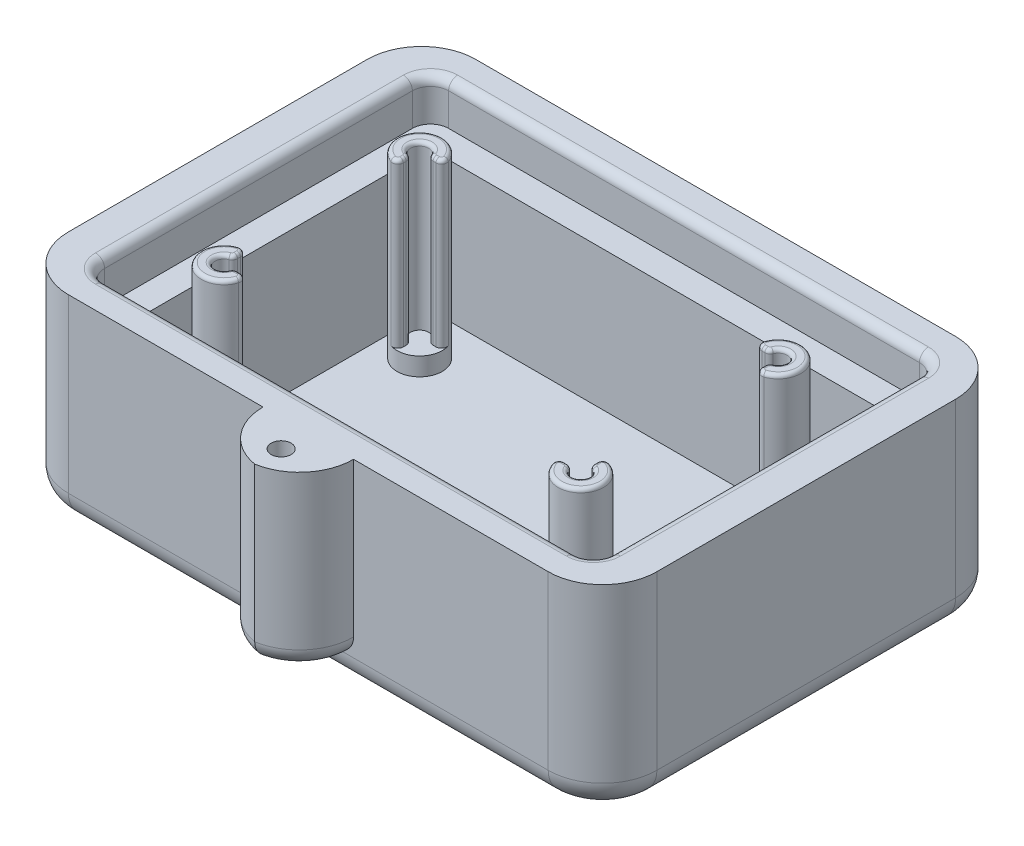
from build123d import *

# Parameters (mm, degrees)
SKETCH1_W               = 82.55
SKETCH1_H               = 57.15
BOSS_EXTRUDE1_DEPTH     = 27.94
FILLET2_R               = 7.62
FILLET3_R               = 3.81
SKETCH2_W               = 63.5
SKETCH2_H               = 40.64
CUT_EXTRUDE1_DEPTH      = 25.4
SKETCH9_W               = 12.7
SKETCH9_H               = 24.13
BOSS_EXTRUDE5_DEPTH     = 7.62
FILLET10_R              = 7.62
SKETCH7_W               = 71.12
SKETCH7_H               = 48.26
CUT_EXTRUDE4_DEPTH      = 5.842
FILLET12_R              = 2.54
FILLET13_R              = 1.27
SKETCH5_R               = 3.175
BOSS_EXTRUDE6_DEPTH     = 25.4
SKETCH11_R              = 1.27
CUT_EXTRUDE5_DEPTH      = 22.86
CUT_EXTRUDE_THIN1_DEPTH = 103.971863203
SKETCH20_R              = 1.397
CUT_EXTRUDE6_DEPTH      = 104.261231406
FILLET14_R              = 2.54
FILLET16_R              = 0.762
FILLET17_R              = 0.508


with BuildPart() as part:
    # Sketch1 → Boss-Extrude1 (new body)
    with BuildSketch(Plane(origin=(0, 0, 0), x_dir=(1, 0, 0), z_dir=(0, 1, 0))):
        with Locations((41.275, 28.575)):
            Rectangle(SKETCH1_W, SKETCH1_H)
    extrude(amount=BOSS_EXTRUDE1_DEPTH)

    # Fillet2
    fillet2_edges = [part.edges().sort_by_distance(p)[0] for p in [
        (0, 13.97, -57.15),
        (82.55, 13.97, -57.15),
        (82.55, 13.97, 0),
        (0, 13.97, 0),
    ]]
    fillet(fillet2_edges, radius=FILLET2_R)

    # Fillet3
    fillet3_edges = [part.edges().sort_by_distance(p)[0] for p in [
        (41.275, 0, -57.15),
        (0, 0, -28.575),
        (82.55, 0, -28.575),
        (41.275, 0, 0),
        (2.231846327, 0, -54.918153673),
        (2.231846327, 0, -2.231846327),
        (80.318153673, 0, -2.231846327),
        (80.318153673, 0, -54.918153673),
    ]]
    fillet(fillet3_edges, radius=FILLET3_R)

    # Sketch2 → Cut-Extrude1 (cut)
    with BuildSketch(Plane(origin=(0, 27.94, 0), x_dir=(1, 0, 0), z_dir=(0, 1, 0))):
        with Locations((41.275, 28.575)):
            Rectangle(SKETCH2_W, SKETCH2_H)
    extrude(amount=-CUT_EXTRUDE1_DEPTH, mode=Mode.SUBTRACT)

    # Sketch9 → Boss-Extrude5 (add)
    with BuildSketch(Plane.XY):
        with Locations((41.275, 15.875)):
            Rectangle(SKETCH9_W, SKETCH9_H)
    extrude(amount=BOSS_EXTRUDE5_DEPTH)

    # Fillet10
    # the kernel refuses this fillet: 7.62 mm, written as the material it takes off along each edge
    with BuildSketch(Plane(origin=(47.625, -15.24, 7.62), x_dir=(-1, 0, 0), z_dir=(0, 1, 0))) as fillet10_piece_1:
        with BuildLine():
            CenterArc((FILLET10_R, -FILLET10_R), FILLET10_R, 90, 90)
            Line((0, -FILLET10_R), (0, 0))
            Line((0, 0), (FILLET10_R, 0))
        make_face()
    extrude(amount=62.23, mode=Mode.SUBTRACT)
    with BuildSketch(Plane(origin=(34.925, 46.99, 7.62), x_dir=(0, 0, -1), z_dir=(0, -1, 0))) as fillet10_piece_2:
        with BuildLine():
            CenterArc((FILLET10_R, FILLET10_R), FILLET10_R, 180, 90)
            Line((0, FILLET10_R), (0, 0))
            Line((0, 0), (FILLET10_R, 0))
        make_face()
    extrude(amount=62.23, mode=Mode.SUBTRACT)

    # Sketch7 → Cut-Extrude4 (cut)
    with BuildSketch(Plane(origin=(0, 27.94, 0), x_dir=(1, 0, 0), z_dir=(0, 1, 0))):
        with Locations((41.275, 28.575)):
            Rectangle(SKETCH7_W, SKETCH7_H)
    extrude(amount=-CUT_EXTRUDE4_DEPTH, mode=Mode.SUBTRACT)

    # Fillet12
    fillet12_edges = [part.edges().sort_by_distance(p)[0] for p in [
        (5.715, 25.019, -52.705),
        (76.835, 25.019, -52.705),
        (76.835, 25.019, -4.445),
        (5.715, 25.019, -4.445),
    ]]
    fillet(fillet12_edges, radius=FILLET12_R)

    # Fillet13
    fillet13_edges = [part.edges().sort_by_distance(p)[0] for p in [
        (41.275, 27.94, -52.705),
        (76.835, 27.94, -28.575),
        (41.275, 27.94, -4.445),
        (5.715, 27.94, -28.575),
        (76.091051224, 27.94, -51.961051224),
        (76.091051224, 27.94, -5.188948776),
        (6.458948776, 27.94, -51.961051224),
        (6.458948776, 27.94, -5.188948776),
    ]]
    fillet(fillet13_edges, radius=FILLET13_R)

    # Sketch5 → Boss-Extrude6 (add)
    with BuildSketch(Plane(origin=(0, 2.54, 0), x_dir=(1, 0, 0), z_dir=(0, 1, 0))):
        with Locations(Location((14.605, 42.291, 0), (0, 0, 90))):
            Circle(SKETCH5_R)
        with Locations(Location((14.605, 14.859, 0), (0, 0, 90))):
            Circle(SKETCH5_R)
        with Locations(Location((64.897, 42.291, 0), (0, 0, 90))):
            Circle(SKETCH5_R)
        with Locations(Location((64.896358582, 14.605, 0), (0, 0, 90))):
            Circle(SKETCH5_R)
    extrude(amount=BOSS_EXTRUDE6_DEPTH)

    # Sketch11 → Cut-Extrude5 (cut)
    with BuildSketch(Plane(origin=(0, 27.94, 0), x_dir=(1, 0, 0), z_dir=(0, 1, 0))):
        with Locations(Location((14.605, 14.859, 0), (0, 0, 270))):
            Circle(SKETCH11_R)
        with Locations(Location((14.605, 42.291, 0), (0, 0, 270))):
            Circle(SKETCH11_R)
        with Locations(Location((64.896358582, 14.605, 0), (0, 0, 270))):
            Circle(SKETCH11_R)
        with Locations(Location((64.897, 42.291, 0), (0, 0, 270))):
            Circle(SKETCH11_R)
    extrude(amount=-CUT_EXTRUDE5_DEPTH, mode=Mode.SUBTRACT)

    # Sketch17 → Cut-Extrude-Thin1 (cut, through all)
    with BuildSketch(Plane(origin=(0, 5.08, 0), x_dir=(1, 0, 0), z_dir=(0, 1, 0))):
        with BuildLine():
            ThreePointArc((18.78, 42.291), (17.557170811, 39.338829189), (14.605, 38.116))
            Line((14.605, 38.116), (14.605, 41.656))
            ThreePointArc((14.605, 41.656), (15.054012806, 41.841987194), (15.24, 42.291))
            Line((15.24, 42.291), (18.78, 42.291))
        make_face()
        with BuildLine():
            ThreePointArc((60.721358582, 14.605), (61.94418777, 17.557170811), (64.896358582, 18.78))
            Line((64.896358582, 18.78), (64.896358582, 15.24))
            ThreePointArc((64.896358582, 15.24), (64.447345776, 15.054012806), (64.261358582, 14.605))
            Line((64.261358582, 14.605), (60.721358582, 14.605))
        make_face()
        with BuildLine():
            ThreePointArc((14.605, 19.034), (17.557170811, 17.811170811), (18.78, 14.859))
            Line((18.78, 14.859), (15.24, 14.859))
            ThreePointArc((15.24, 14.859), (15.054012806, 15.308012806), (14.605, 15.494))
            Line((14.605, 15.494), (14.605, 19.034))
        make_face()
        with BuildLine():
            ThreePointArc((64.627, 42.291), (64.706081169, 42.100081169), (64.897, 42.021))
            Line((64.897, 42.021), (64.897, 38.481))
            ThreePointArc((64.897, 38.481), (62.202923164, 39.596923164), (61.087, 42.291))
            Line((61.087, 42.291), (64.627, 42.291))
        make_face()
    extrude(amount=CUT_EXTRUDE_THIN1_DEPTH, mode=Mode.SUBTRACT)

    # Sketch20 → Cut-Extrude6 (cut, through all)
    with BuildSketch(Plane.XZ.offset(-3.81)):
        with Locations(Location((41.275, 3.81, 0), (0, 0, 270))):
            Circle(SKETCH20_R)
    extrude(amount=-CUT_EXTRUDE6_DEPTH, mode=Mode.SUBTRACT)

    # Fillet14
    # the kernel refuses this fillet: 2.54 mm, written as the material it takes off along each edge
    with BuildSketch(Plane(origin=(42.545, 3.81, 0), x_dir=(-1, 0, 0), z_dir=(0, 0, -1))) as fillet14_piece_1:
        with BuildLine():
            CenterArc((7.62 - FILLET14_R, FILLET14_R), FILLET14_R, 270, 90)
            Line((7.62 - FILLET14_R, 0), (7.62, 0))
            Line((7.62, 0), (7.62, FILLET14_R))
        make_face()
    revolve(axis=Axis((42.545, 3.81, 0), (0, 1, 0)), revolution_arc=128.167722704, mode=Mode.SUBTRACT)
    with BuildSketch(Plane(origin=(40.005, 3.81, 0), x_dir=(1, 0, 0), z_dir=(0, 0, -1))) as fillet14_piece_2:
        with BuildLine():
            CenterArc((7.62 - FILLET14_R, -FILLET14_R), FILLET14_R, 0, 90)
            Line((7.62 - FILLET14_R, 0), (7.62, 0))
            Line((7.62, 0), (7.62, -FILLET14_R))
        make_face()
    revolve(axis=Axis((40.005, 3.81, 0), (0, -1, 0)), revolution_arc=128.167722704, mode=Mode.SUBTRACT)

    # Fillet16
    # the kernel refuses this fillet: 0.762 mm, written as the material it takes off along each edge
    with BuildSketch(Plane(origin=(14.605, 30.47927354, -39.116), x_dir=(-0.9871244306106606, 0, -0.1599542387421456), z_dir=(0, -1, 0)), Plane(origin=(17.78, 30.47927354, -14.859), x_dir=(-0.15995423874214412, 0, 0.9871244306106608), z_dir=(0, -1, 0)), Plane(origin=(14.605, 5.08, -18.034), x_dir=(-0.9871244306106601, 0, 0.1599542387421475), z_dir=(0, 1, 0)), Plane(origin=(61.722, 30.47927354, -42.291), x_dir=(0.15995423874221992, 0, -0.9871244306106485), z_dir=(0, -1, 0))) as fillet16_piece_1:
        with BuildLine():
            CenterArc((0.893824286, 0.752188816), FILLET16_R, 170.795759915, 108.408480171)
            Line((0.14163547, 0.874073946), (0, 0))
            ThreePointArc((0, 0), (0.507854708, -0.040879933), (1.015709416, 0))
        make_face()
    extrude(amount=25.39927354, mode=Mode.SUBTRACT)
    with BuildSketch(Plane(origin=(14.605, 29.474286039, -41.021), x_dir=(0, 0, 1), z_dir=(0, -1, 0)), Plane(origin=(14.605, 5.08, -16.129), x_dir=(0, 0, -1), z_dir=(0, 1, 0))) as fillet16_piece_2:
        with BuildLine():
            CenterArc((0.613714416, 0.762), FILLET16_R, 202.024312837, 67.975687163)
            ThreePointArc((-0.09267849, 0.47625), (-0.02338492, 0.242591923), (0, 0))
            Line((0, 0), (0.613714416, 0))
        make_face()
    extrude(amount=24.394286039, mode=Mode.SUBTRACT)
    with BuildSketch(Plane(origin=(17.78, 30.47927354, -42.291), x_dir=(-0.1599542387421499, 0, -0.9871244306106597), z_dir=(0, -1, 0)), Plane(origin=(64.897, 30.47927354, -39.116), x_dir=(0.9871244306106357, 0, -0.1599542387422978), z_dir=(0, -1, 0)), Plane(origin=(64.896358582, 5.08, -17.78), x_dir=(0.9871244306106608, 0, 0.159954238742144), z_dir=(0, 1, 0)), Plane(origin=(61.721358582, 30.47927354, -14.605), x_dir=(0.1599542387421526, 0, 0.9871244306106594), z_dir=(0, -1, 0))) as fillet16_piece_3:
        with BuildLine():
            CenterArc((0.893824286, -0.752188816), FILLET16_R, 80.795759915, 108.408480171)
            Line((0.14163547, -0.874073946), (0, 0))
            ThreePointArc((0, 0), (0.507854708, 0.040879933), (1.015709416, 0))
        make_face()
    extrude(amount=25.39927354, mode=Mode.SUBTRACT)
    with BuildSketch(Plane(origin=(15.875, 5.08, -42.291), x_dir=(-0.19101726245689768, 0, -0.9815866774989729), z_dir=(0, 1, 0)), Plane(origin=(63.626358582, 5.08, -14.605), x_dir=(0.19101726245692474, 0, 0.9815866774989677), z_dir=(0, 1, 0))) as fillet16_piece_4:
        with BuildLine():
            CenterArc((0.630739001, -0.747969048), FILLET16_R, 101.012156419, 67.975687163)
            Line((-0.117230048, -0.602413894), (0, 0))
            ThreePointArc((0, 0), (0.242591923, -0.02338492), (0.485183847, 0))
        make_face()
    extrude(amount=24.394286039, mode=Mode.SUBTRACT)
    with BuildSketch(Plane(origin=(15.875, 5.08, -14.859), x_dir=(-0.19101726245687592, 0, 0.9815866774989771), z_dir=(0, 1, 0)), Plane(origin=(64.897, 29.474286039, -41.021), x_dir=(0.9815866774989668, 0, -0.19101726245692938), z_dir=(0, -1, 0)), Plane(origin=(64.896358582, 5.08, -15.875), x_dir=(0.9815866774989799, 0, 0.191017262456862), z_dir=(0, 1, 0))) as fillet16_piece_5:
        with BuildLine():
            CenterArc((0.630739001, 0.747969048), FILLET16_R, 191.012156419, 67.975687163)
            Line((-0.117230048, 0.602413894), (0, 0))
            ThreePointArc((0, 0), (0.242591923, 0.02338492), (0.485183847, 0))
        make_face()
    extrude(amount=24.394286039, mode=Mode.SUBTRACT)
    with BuildSketch(Plane(origin=(63.627, 5.08, -42.291), x_dir=(-1, 0, 0), z_dir=(0, 1, 0))) as fillet16_piece_6:
        with BuildLine():
            CenterArc((0.613714416, -0.762), FILLET16_R, 90, 67.975687163)
            ThreePointArc((-0.09267849, -0.47625), (-0.02338492, -0.242591923), (0, 0))
            Line((0, 0), (0.613714416, 0))
        make_face()
    extrude(amount=24.394286039, mode=Mode.SUBTRACT)

    # Fillet17
    fillet17_edges = [part.edges().sort_by_distance(p)[0] for p in [
        (11.470879933, 27.94, -42.798854708),
        (16.691619738, 27.94, -42.291),
        (14.605, 27.94, -40.204380262),
        (13.706974388, 27.94, -43.189025612),
        (14.288692011, 27.94, -39.383411326),
        (14.474817023, 27.94, -40.833256534),
        (16.062743466, 27.94, -42.421182977),
        (17.512588674, 27.94, -42.607307989),
        (68.031120067, 27.94, -42.798854708),
        (64.897, 27.94, -40.204380262),
        (62.810380262, 27.94, -42.291),
        (65.795025612, 27.94, -43.189025612),
        (65.213307989, 27.94, -39.383411326),
        (65.027182977, 27.94, -40.833256534),
        (63.439256534, 27.94, -42.421182977),
        (61.989411326, 27.94, -42.607307989),
        (67.141422612, 27.94, -12.35993597),
        (64.896358582, 27.94, -16.691619738),
        (65.794384194, 27.94, -13.706974388),
        (62.809738844, 27.94, -14.605),
        (61.988769907, 27.94, -14.288692011),
        (63.438615116, 27.94, -14.474817023),
        (65.026541559, 27.94, -16.062743466),
        (65.212666571, 27.94, -17.512588674),
        (12.35993597, 27.94, -12.61393597),
        (14.605, 27.94, -16.945619738),
        (16.691619738, 27.94, -14.859),
        (13.706974388, 27.94, -13.960974388),
        (17.512588674, 27.94, -14.542692011),
        (16.062743466, 27.94, -14.728817023),
        (14.474817023, 27.94, -16.316743466),
        (14.288692011, 27.94, -17.766588674),
    ]]
    fillet(fillet17_edges, radius=FILLET17_R)


solid = part.part
